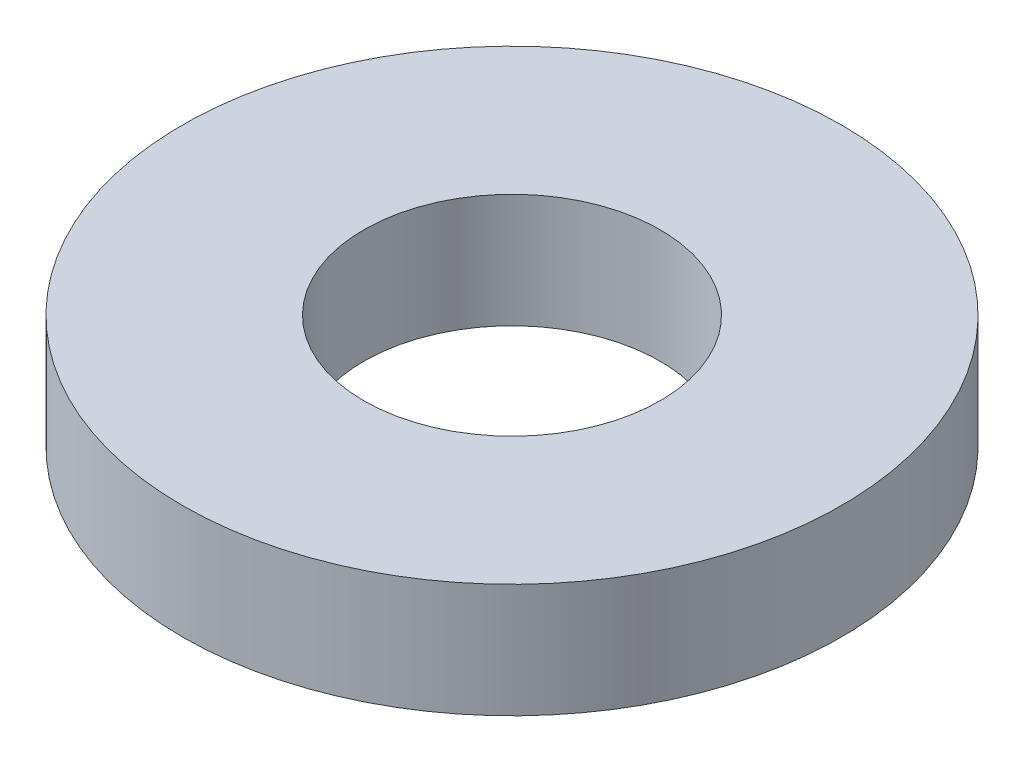
from build123d import *

# Parameters (mm, degrees)
SKETCH1_R           = 7.9375
SKETCH1_R_2         = 3.5687
BOSS_EXTRUDE1_DEPTH = 2.7432


with BuildPart() as part:
    # Sketch1 → Boss-Extrude1 (new body)
    with BuildSketch(Plane(origin=(0, 0, 0), x_dir=(1, 0, 0), z_dir=(0, 1, 0))):
        Circle(SKETCH1_R)
        Circle(SKETCH1_R_2, mode=Mode.SUBTRACT)
    extrude(amount=BOSS_EXTRUDE1_DEPTH)


solid = part.part
